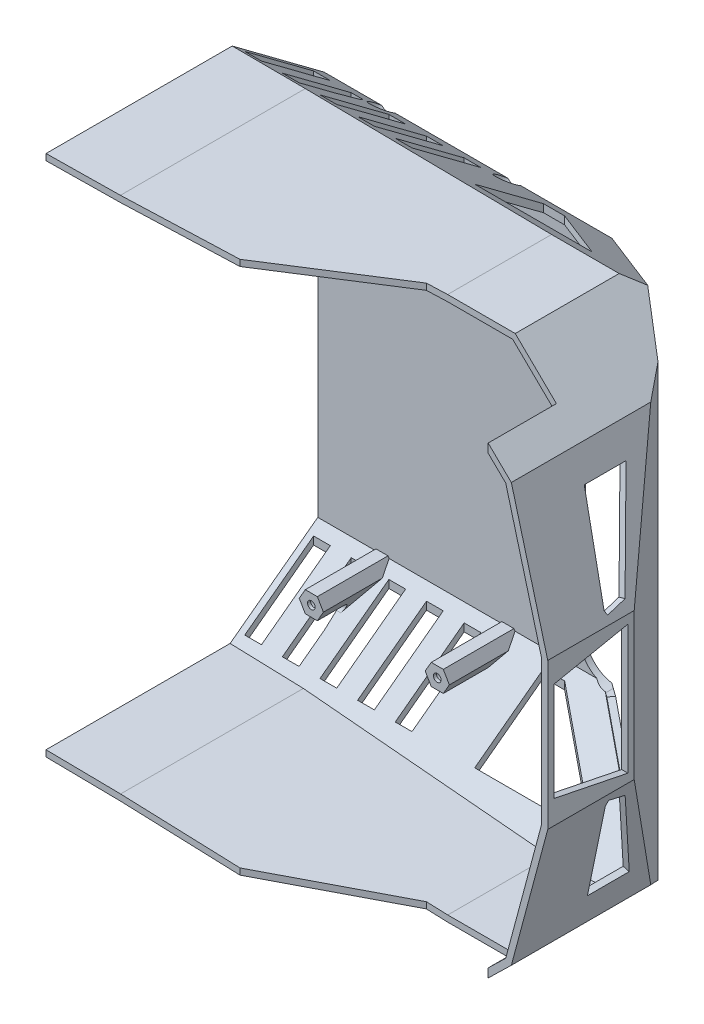
from build123d import *
from OCP.BRepFilletAPI import BRepFilletAPI_MakeChamfer

# Parameters (mm, degrees)
CROQUIS2_W                  = 265
CROQUIS2_H                  = 158
SALIENTE_EXTRUIR1_DEPTH     = 260
CROQUIS3_W                  = 265
CROQUIS3_H                  = 50
CORTAR_EXTRUIR1_DEPTH       = 260
CROQUIS37_W                 = 265
CROQUIS37_H                 = 260
SALIENTE_EXTRUIR3_DEPTH     = 25
CROQUIS5_W                  = 20
CROQUIS5_H                  = 133
CORTAR_EXTRUIR2_DEPTH       = 260
CORTAR_EXTRUIR20_DEPTH      = 319.661654424
CORTAR_EXTRUIR4_REACH       = 363.232
VACIADO1_T                  = -3
CORTAR_EXTRUIR5_REACH       = 328.59
CORTAR_EXTRUIR22_START      = -3
CROQUIS41_W                 = 47.746478281
CROQUIS41_H                 = 184.45091499
CORTAR_EXTRUIR22_DEPTH      = 10
REDONDEO1_R                 = 15
CORTAR_EXTRUIR13_REACH      = 363.169
CORTAR_EXTRUIR14_REACH      = 359.396
CORTAR_EXTRUIR21_DEPTH      = 362.802055632
CROQUIS51_W                 = 8
CROQUIS51_H                 = 32.94381508
CORTAR_EXTRUIR28_DEPTH      = 301.162039572
CORTAR_EXTRUIR29_DEPTH      = 298.567219297
CORTAR_EXTRUIR29_DEPTH_BACK = 298.567219297
CROQUIS44_R                 = 1.825
SALIENTE_EXTRUIR4_DEPTH     = 36.8
CROQUIS47_R                 = 1.825
CORTAR_EXTRUIR25_DEPTH      = 319.661654424
CROQUIS49_R                 = 4
CORTAR_EXTRUIR27_DEPTH      = 35.3
CORTAR_EXTRUIR26_DEPTH      = 363.547927866
REDONDEO2_R                 = 3
CHAFL_N1_SIZE               = 10
CHAFL_N1_SIZE2              = 1.139356083


with BuildPart() as part:
    # Croquis2 → Saliente-Extruir1 (new body)
    with BuildSketch(Plane(origin=(0, 0, 0), x_dir=(1, 0, 0), z_dir=(0, 1, 0))):
        Rectangle(CROQUIS2_W, CROQUIS2_H)
    extrude(amount=SALIENTE_EXTRUIR1_DEPTH)

    # Croquis3 → Cortar-Extruir1 (cut)
    with BuildSketch(Plane(origin=(0, 260, 0), x_dir=(1, 0, 0), z_dir=(0, 1, 0))):
        with Locations((0, -54)):
            Rectangle(CROQUIS3_W, CROQUIS3_H)
    extrude(amount=-CORTAR_EXTRUIR1_DEPTH, mode=Mode.SUBTRACT)

    # Croquis37 → Saliente-Extruir3 (add)
    with BuildSketch(Plane.XY.offset(29)):
        with Locations((0, 130)):
            Rectangle(CROQUIS37_W, CROQUIS37_H)
    extrude(amount=SALIENTE_EXTRUIR3_DEPTH)

    # Croquis5 → Cortar-Extruir2 (cut)
    with BuildSketch(Plane(origin=(0, 260, 0), x_dir=(1, 0, 0), z_dir=(0, 1, 0))):
        Polygon((102.498828702, 23.726929966), (25.196336872, 79), (132.5, 79), (132.5, -54), (127.5, -54), (127.5, -12.65), align=None)
        with Locations((-122.5, 12.5)):
            Rectangle(CROQUIS5_W, CROQUIS5_H)
    extrude(amount=-CORTAR_EXTRUIR2_DEPTH, mode=Mode.SUBTRACT)

    # Croquis7 → Cortar-Extruir20 (cut, through all)
    with BuildSketch(Plane(origin=(0, 0, -79), x_dir=(-1, 0, 0), z_dir=(0, 0, -1))):
        Polygon((-127.5, 165), (-110.083302492, 230), (-78.125566824, 261.138037136), (76.905884209, 255.475592033), (112.5, 255), (112.5, 266.138037136), (-127.5, 266.138037136), (-127.5, 250.046344973), align=None)
        Polygon((-78.125566824, -1.138037136), (76.905884209, 4.524407967), (112.5, 5), (112.5, -6.138037136), (-127.5, -6.138037136), (-127.5, 9.953655027), (-127.5, 95), (-110.083302492, 30), align=None)
    extrude(amount=-CORTAR_EXTRUIR20_DEPTH, mode=Mode.SUBTRACT)

    # Cortar-Extruir4: up to this face of the body (flat: up to its plane)
    cortar_extruir4_end = Plane(part.part.faces().sort_by_distance((127.5, 130, 33.325))[0])
    # Croquis8 → Cortar-Extruir4 (cut, up to the picked face)
    with BuildSketch(Plane(origin=(-112.5, 0, -18.721920202), x_dir=(0, 0, -1), z_dir=(1, 0, 0)), mode=Mode.PRIVATE) as cortar_extruir4_sk1:
        Polygon((60.278079798, 263.608979804), (4.79142117, 263.608979804), (60.278079798, 222.225457495), align=None)
    cortar_extruir4_tool1 = split(extrude(cortar_extruir4_sk1.sketch, amount=CORTAR_EXTRUIR4_REACH, mode=Mode.PRIVATE), bisect_by=cortar_extruir4_end, keep=Keep.BOTH, mode=Mode.PRIVATE)
    # Croquis8 → Cortar-Extruir4 (cut, up to the picked face)
    with BuildSketch(Plane(origin=(-112.5, 0, -18.721920202), x_dir=(0, 0, -1), z_dir=(1, 0, 0)), mode=Mode.PRIVATE) as cortar_extruir4_sk2:
        Polygon((60.278079798, -3.608979804), (60.278079798, 37.774542505), (4.79142117, -3.608979804), align=None)
    cortar_extruir4_tool2 = split(extrude(cortar_extruir4_sk2.sketch, amount=CORTAR_EXTRUIR4_REACH, mode=Mode.PRIVATE), bisect_by=cortar_extruir4_end, keep=Keep.BOTH, mode=Mode.PRIVATE)
    add(cortar_extruir4_tool1.solids().sort_by(Axis((-112.5, 249.814472, -60.504447), (1, 0, 0)))[0], mode=Mode.SUBTRACT)
    add(cortar_extruir4_tool2.solids().sort_by(Axis((-112.5, 10.185528, -60.504447), (1, 0, 0)))[0], mode=Mode.SUBTRACT)

    # Vaciado1
    vaciado1_openings = [part.faces().sort_by_distance(p)[0] for p in [
        (-112.5, 130, -10.152313993),
        (2.843460246, 130, 54),
    ]]
    offset(amount=VACIADO1_T, openings=vaciado1_openings, kind=Kind.INTERSECTION)

    # Croquis9 → Cortar-Extruir5 (cut, up to next)
    with BuildSketch(Plane(origin=(45.901265515, 0, -64.195497016), x_dir=(-0.8134496593260037, 0, -0.5816353253907545), z_dir=(0.5816353253907545, 0, -0.8134496593260037)), mode=Mode.PRIVATE) as cortar_extruir5_sk1:
        Polygon((22.453239061, 39.743255759), (22.453239061, 220.256744241), (-47.873067815, 250.764303706), (-66.577216658, 235.939673686), (-66.577216658, 24.060326314), (-47.873067815, 9.235696294), align=None)
    cortar_extruir5_tool1 = extrude(cortar_extruir5_sk1.sketch, amount=-CORTAR_EXTRUIR5_REACH, mode=Mode.PRIVATE) & part.part
    add(cortar_extruir5_tool1.solids().sort_by_distance((65.322553, 130, -50.308827))[0], mode=Mode.SUBTRACT)

    # Croquis41 → Cortar-Extruir22 (cut)
    with BuildSketch(Plane.XY.offset(-76).offset(CORTAR_EXTRUIR22_START)):
        with Locations((36.386960155, 130)):
            Rectangle(CROQUIS41_W, CROQUIS41_H)
    extrude(amount=CORTAR_EXTRUIR22_DEPTH, mode=Mode.SUBTRACT)

    # Redondeo1
    # the kernel refuses this fillet: 15 mm, written as the material it adds along each edge
    with BuildSketch(Plane(origin=(12.513721014, 37.774542505, -79), x_dir=(0, 1, 0), z_dir=(0, 0, 1))) as redondeo1_piece_1_section:
        with BuildLine():
            CenterArc((REDONDEO1_R, -REDONDEO1_R), REDONDEO1_R, 90, 90)
            Line((0, -REDONDEO1_R), (0, 0))
            Line((0, 0), (REDONDEO1_R, 0))
        make_face()
    redondeo1_piece_1 = extrude(amount=42.517916609, mode=Mode.PRIVATE)
    redondeo1_piece_1 = split(redondeo1_piece_1, bisect_by=Plane(origin=(24.125219439, 38.179578955, -79.765873744), z_dir=(-0.5816353253907545, 0, 0.8134496593260038)), keep=Keep.TOP, mode=Mode.PRIVATE)
    redondeo1_piece_1 = split(redondeo1_piece_1, bisect_by=Plane(origin=(22.879605897, 39.856291315, -76.773273679), z_dir=(0, -0.8016022644075256, -0.5978576834805485)), keep=Keep.TOP, mode=Mode.PRIVATE)
    add(redondeo1_piece_1)
    with BuildSketch(Plane(origin=(12.513721014, 37.774542505, -79), x_dir=(0, 1, 0), z_dir=(0, 0, 1))) as redondeo1_piece_2_section:
        with BuildLine():
            CenterArc((REDONDEO1_R, -REDONDEO1_R), REDONDEO1_R, 90, 90)
            Line((0, -REDONDEO1_R), (0, 0))
            Line((0, 0), (REDONDEO1_R, 0))
        make_face()
    redondeo1_piece_2 = extrude(amount=42.517916609, mode=Mode.PRIVATE)
    redondeo1_piece_2 = split(redondeo1_piece_2, bisect_by=Plane(origin=(14.427694149, 43.248164762, -76), z_dir=(0, 0, -1)), keep=Keep.TOP, mode=Mode.PRIVATE)
    redondeo1_piece_2 = split(redondeo1_piece_2, bisect_by=Plane(origin=(14.427694149, 41.344560187, -78.768731346), z_dir=(0, 0.8016022644075256, 0.5978576834805485)), keep=Keep.TOP, mode=Mode.PRIVATE)
    add(redondeo1_piece_2)
    with BuildSketch(Plane(origin=(12.513721014, 37.774542505, -116.5), x_dir=(0, 1, 0), z_dir=(0, 0, 1))) as redondeo1_piece_3_section:
        with BuildLine():
            CenterArc((REDONDEO1_R, -REDONDEO1_R), REDONDEO1_R, 90, 90)
            Line((0, -REDONDEO1_R), (0, 0))
            Line((0, 0), (REDONDEO1_R, 0))
        make_face()
    redondeo1_piece_3 = extrude(amount=80.017916609, mode=Mode.PRIVATE)
    redondeo1_piece_3 = split(redondeo1_piece_3, bisect_by=Plane(origin=(27.235418202, 37.77600802, -76), z_dir=(0, 0, 1)), keep=Keep.TOP, mode=Mode.PRIVATE)
    redondeo1_piece_3 = split(redondeo1_piece_3, bisect_by=Plane(origin=(27.204656218, 37.77600802, -73.876008086), z_dir=(0.5816353253907545, 0, -0.8134496593260038)), keep=Keep.TOP, mode=Mode.PRIVATE)
    add(redondeo1_piece_3)
    with BuildSketch(Plane(origin=(12.513721014, 222.225457495, -79), x_dir=(0, -1, 0), z_dir=(0, 0, 1))) as redondeo1_piece_4_section:
        with BuildLine():
            CenterArc((REDONDEO1_R, REDONDEO1_R), REDONDEO1_R, 180, 90)
            Line((0, REDONDEO1_R), (0, 0))
            Line((0, 0), (REDONDEO1_R, 0))
        make_face()
    redondeo1_piece_4 = extrude(amount=42.517916609, mode=Mode.PRIVATE)
    redondeo1_piece_4 = split(redondeo1_piece_4, bisect_by=Plane(origin=(24.125219439, 221.820421045, -79.765873744), z_dir=(-0.5816353253907545, 0, 0.8134496593260038)), keep=Keep.TOP, mode=Mode.PRIVATE)
    redondeo1_piece_4 = split(redondeo1_piece_4, bisect_by=Plane(origin=(22.879605897, 220.143708685, -76.773273679), z_dir=(0, 0.8016022644075256, -0.5978576834805485)), keep=Keep.TOP, mode=Mode.PRIVATE)
    add(redondeo1_piece_4)
    with BuildSketch(Plane(origin=(12.513721014, 222.225457495, -79), x_dir=(0, -1, 0), z_dir=(0, 0, 1))) as redondeo1_piece_5_section:
        with BuildLine():
            CenterArc((REDONDEO1_R, REDONDEO1_R), REDONDEO1_R, 180, 90)
            Line((0, REDONDEO1_R), (0, 0))
            Line((0, 0), (REDONDEO1_R, 0))
        make_face()
    redondeo1_piece_5 = extrude(amount=42.517916609, mode=Mode.PRIVATE)
    redondeo1_piece_5 = split(redondeo1_piece_5, bisect_by=Plane(origin=(14.427694149, 218.655439813, -78.768731346), z_dir=(0, -0.8016022644075256, 0.5978576834805485)), keep=Keep.TOP, mode=Mode.PRIVATE)
    redondeo1_piece_5 = split(redondeo1_piece_5, bisect_by=Plane(origin=(14.427694149, 216.751835238, -76), z_dir=(0, 0, -1)), keep=Keep.TOP, mode=Mode.PRIVATE)
    add(redondeo1_piece_5)
    with BuildSketch(Plane(origin=(12.513721014, 222.225457495, -116.5), x_dir=(0, -1, 0), z_dir=(0, 0, 1))) as redondeo1_piece_6_section:
        with BuildLine():
            CenterArc((REDONDEO1_R, REDONDEO1_R), REDONDEO1_R, 180, 90)
            Line((0, REDONDEO1_R), (0, 0))
            Line((0, 0), (REDONDEO1_R, 0))
        make_face()
    redondeo1_piece_6 = extrude(amount=80.017916609, mode=Mode.PRIVATE)
    redondeo1_piece_6 = split(redondeo1_piece_6, bisect_by=Plane(origin=(27.235418202, 222.22399198, -76), z_dir=(0, 0, 1)), keep=Keep.TOP, mode=Mode.PRIVATE)
    redondeo1_piece_6 = split(redondeo1_piece_6, bisect_by=Plane(origin=(27.204656218, 222.22399198, -73.876008086), z_dir=(0.5816353253907545, 0, -0.8134496593260038)), keep=Keep.TOP, mode=Mode.PRIVATE)
    add(redondeo1_piece_6)

    # Croquis18 → Cortar-Extruir13 (cut, up to next)
    with BuildSketch(Plane(origin=(127.5, 0, -6.590951762), x_dir=(0, 0, -1), z_dir=(1, 0, 0)), mode=Mode.PRIVATE) as cortar_extruir13_sk1:
        Polygon((-22.240951762, 99.1343583), (-22.240951762, 160.8656417), (-57.590951762, 153.685327256), (-57.590951762, 106.314672744), align=None)
    cortar_extruir13_tool1 = extrude(cortar_extruir13_sk1.sketch, amount=-CORTAR_EXTRUIR13_REACH, mode=Mode.PRIVATE) & part.part
    add(cortar_extruir13_tool1.solids().sort_by_distance((127.5, 130, 32.549505))[0], mode=Mode.SUBTRACT)

    # Croquis19 → Cortar-Extruir14 (cut, up to next)
    with BuildSketch(Plane(origin=(160.209119491, 42.927904188, 0), x_dir=(0, 0, -1), z_dir=(0.9659258262890703, 0.25881904510251375, 0)), mode=Mode.PRIVATE) as cortar_extruir14_sk1:
        Polygon((-23.018362405, 178.671284814), (-3.018362405, 178.671284814), (-15.530071488, 132.174236919), (-24.434937144, 130.011119187), (-25.54961608, 132.174236919), align=None)
    cortar_extruir14_tool1 = extrude(cortar_extruir14_sk1.sketch, amount=-CORTAR_EXTRUIR14_REACH, mode=Mode.PRIVATE) & part.part
    add(cortar_extruir14_tool1.solids().sort_by_distance((119.420968, 195.151357, 16.446057))[0], mode=Mode.SUBTRACT)

    # Croquis40 → Cortar-Extruir21 (cut, through all)
    with BuildSketch(Plane(origin=(95.209119491, -25.51120668, 0), x_dir=(0, 0, -1), z_dir=(0.9659258262890704, -0.2588190451025127, 0))):
        Polygon((-21.49024239, 72.469430021), (-1.49024239, 72.469430021), (-15.383564866, 118.571470004), (-23.901353491, 121.151639949), (-24.970399716, 118.969430021), align=None)
    extrude(amount=-CORTAR_EXTRUIR21_DEPTH, mode=Mode.SUBTRACT)

    # Croquis51 → Cortar-Extruir28 (cut, through all)
    with BuildSketch(Plane(origin=(0, 0, 0), x_dir=(1, 0, 0), z_dir=(0, 1, 0))):
        with Locations((-105.5, 54.52809246)):
            Rectangle(CROQUIS51_W, CROQUIS51_H)
        with Locations((-87.5, 54.52809246)):
            Rectangle(CROQUIS51_W, CROQUIS51_H)
        with Locations((-69.5, 54.52809246)):
            Rectangle(CROQUIS51_W, CROQUIS51_H)
        with Locations((-51.5, 54.52809246)):
            Rectangle(CROQUIS51_W, CROQUIS51_H)
        with Locations((-33.5, 54.52809246)):
            Rectangle(CROQUIS51_W, CROQUIS51_H)
        Polygon((0.5, 71), (10.595430849, 71), (56.669205917, 38.05618492), (0.5, 38.05618492), align=None)
    extrude(amount=CORTAR_EXTRUIR28_DEPTH, mode=Mode.SUBTRACT)

    # Croquis52 → Cortar-Extruir29 (cut, two sides: drawn at the far end of the back side and taken through both)
    with BuildSketch(Plane.XZ.offset(-257).offset(-CORTAR_EXTRUIR29_DEPTH_BACK)):
        Polygon((98.993302903, 54), (98.993302903, 21.34970113), (36.779448063, 21.34970113), (-19.738783425, 54), align=None)
    extrude(amount=CORTAR_EXTRUIR29_DEPTH + CORTAR_EXTRUIR29_DEPTH_BACK, mode=Mode.SUBTRACT)

    # Croquis44 → Saliente-Extruir4 (add)
    # profile 1 of 4: a face of its own
    with BuildSketch(Plane(origin=(0, 0, -79), x_dir=(-1, 0, 0), z_dir=(0, 0, -1))):
        Polygon((87.571905627, 35.126465683), (84.684405627, 40.12776239), (78.909405627, 40.12776239), (76.021905627, 35.126465683), (78.909405627, 30.125168976), (84.684405627, 30.125168976), align=None)
        with Locations(Location((81.796905627, 35.126465683, 0), (0, 0, 13.432747108))):
            Circle(CROQUIS44_R, mode=Mode.SUBTRACT)
    # profile 2 of 4: a face of its own
    with BuildSketch(Plane(origin=(0, 0, -79), x_dir=(-1, 0, 0), z_dir=(0, 0, -1))):
        Polygon((27.327479414, 35.126465683), (24.439979414, 40.12776239), (18.664979414, 40.12776239), (15.777479414, 35.126465683), (18.664979414, 30.125168976), (24.439979414, 30.125168976), align=None)
        with Locations(Location((21.552479414, 35.126465683, 0), (0, 0, 90))):
            Circle(CROQUIS44_R, mode=Mode.SUBTRACT)
    # profile 3 of 4: a face of its own
    with BuildSketch(Plane(origin=(0, 0, -79), x_dir=(-1, 0, 0), z_dir=(0, 0, -1))):
        Polygon((24.439979414, 229.874831024), (27.327479414, 224.873534317), (24.439979414, 219.87223761), (18.664979414, 219.87223761), (15.777479414, 224.873534317), (18.664979414, 229.874831024), align=None)
        with Locations(Location((21.552479414, 224.873534317, 0), (0, 0, 270))):
            Circle(CROQUIS44_R, mode=Mode.SUBTRACT)
    # profile 4 of 4: a face of its own
    with BuildSketch(Plane(origin=(0, 0, -79), x_dir=(-1, 0, 0), z_dir=(0, 0, -1))):
        Polygon((84.684405627, 229.874831024), (87.571905627, 224.873534317), (84.684405627, 219.87223761), (78.909405627, 219.87223761), (76.021905627, 224.873534317), (78.909405627, 229.874831024), align=None)
        with Locations(Location((81.796905627, 224.873534317, 0), (0, 0, 346.567252892))):
            Circle(CROQUIS44_R, mode=Mode.SUBTRACT)
    extrude(amount=-SALIENTE_EXTRUIR4_DEPTH)

    # Croquis47 → Cortar-Extruir25 (cut, through all)
    with BuildSketch(Plane(origin=(0, 0, -79), x_dir=(-1, 0, 0), z_dir=(0, 0, -1))):
        with Locations(Location((81.796905627, 224.845470999, 0), (0, 0, 0.440527537))):
            Circle(CROQUIS47_R)
        with Locations(Location((21.552479414, 224.845470999, 0), (0, 0, 0.440527536))):
            Circle(CROQUIS47_R)
        with Locations(Location((21.552479414, 35.154529001, 0), (0, 0, 359.559472464))):
            Circle(CROQUIS47_R)
        with Locations(Location((81.796905627, 35.154529001, 0), (0, 0, 359.559472464))):
            Circle(CROQUIS47_R)
    extrude(amount=-CORTAR_EXTRUIR25_DEPTH, mode=Mode.SUBTRACT)

    # Croquis49 → Cortar-Extruir27 (cut)
    with BuildSketch(Plane(origin=(0, 0, -79), x_dir=(-1, 0, 0), z_dir=(0, 0, -1))):
        with Locations((81.796905627, 224.845470999)):
            Circle(CROQUIS49_R)
        with Locations((21.552479414, 224.845470999)):
            Circle(CROQUIS49_R)
        with Locations((81.796905627, 35.154529001)):
            Circle(CROQUIS49_R)
        with Locations((21.552479414, 35.154529001)):
            Circle(CROQUIS49_R)
    extrude(amount=-CORTAR_EXTRUIR27_DEPTH, mode=Mode.SUBTRACT)

    # Croquis48 → Cortar-Extruir26 (cut, through all)
    with BuildSketch(Plane.ZY.offset(112.5)):
        Polygon((-79, 37.774542505), (-79, 30.125168976), (-68.743788009, 30.125168976), align=None)
        Polygon((-79, 222.225457495), (-79, 229.874831024), (-68.743788009, 229.874831024), align=None)
    extrude(amount=-CORTAR_EXTRUIR26_DEPTH, mode=Mode.SUBTRACT)

    # Redondeo2
    redondeo2_edges = [part.edges().sort_by_distance(p)[0] for p in [
        (-81.204702814, 229.874831024, -63.7258714),
        (-81.204702814, 30.125168976, -63.7258714),
    ]]
    fillet(redondeo2_edges, radius=REDONDEO2_R)

    # Chaflán1: one chamfer whose edges measure the first distance from different faces: ONE call of the kernel's chamfer builder (chamfer() names one face for all edges)
    chafl_n1_edges_1 = [part.edges().sort_by_distance(p)[0] for p in [
        (-83.5, 229.874831024, -61.714684741),
    ]]
    chafl_n1_side_1 = [part.faces().sort_by_distance(p)[0] for p in [
        (-83.5, 239.223872978, -53.116860251),
    ]]
    chafl_n1_edges_2 = [part.edges().sort_by_distance(p)[0] for p in [
        (-83.5, 30.125168976, -61.714684741),
    ]]
    chafl_n1_side_2 = [part.faces().sort_by_distance(p)[0] for p in [
        (-83.5, 20.776127022, -53.116860251),
    ]]
    chafl_n1 = BRepFilletAPI_MakeChamfer(part.part.solid().wrapped)
    for e in chafl_n1_edges_1:
        chafl_n1.Add(CHAFL_N1_SIZE, CHAFL_N1_SIZE2, e.wrapped, chafl_n1_side_1[0].wrapped)  # the first distance lies on this face
    for e in chafl_n1_edges_2:
        chafl_n1.Add(CHAFL_N1_SIZE, CHAFL_N1_SIZE2, e.wrapped, chafl_n1_side_2[0].wrapped)  # the first distance lies on this face
    add(Compound.cast(chafl_n1.Shape()), mode=Mode.REPLACE)


solid = part.part
